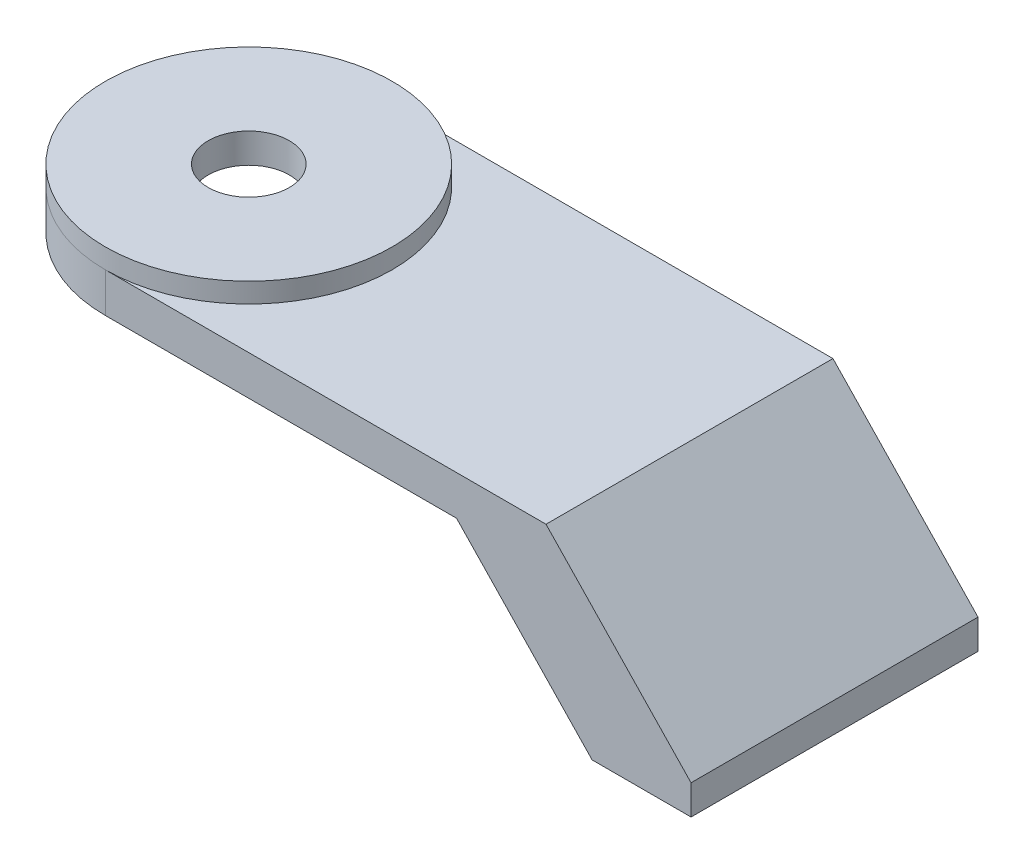
from build123d import *

# Parameters (mm, degrees)
BOSS_EXTRUDE1_DEPTH = 14.5
SKETCH3_R           = 4.1
CUT_EXTRUDE1_DEPTH  = 4
BOSS_EXTRUDE2_START = 2
SKETCH5_R           = 14.5
SKETCH5_R_2         = 4.1
BOSS_EXTRUDE2_DEPTH = 2
SKETCH6_R           = 1.55
CUT_EXTRUDE3_DEPTH  = 3
SKETCH7_R           = 10.5
CUT_EXTRUDE4_DEPTH  = 3
FILLET1_R           = 14.5
CUT_EXTRUDE5_DEPTH  = 3
SKETCH9_R           = 1.55
CUT_EXTRUDE6_DEPTH  = 3
SKETCH10_R          = 3
CUT_EXTRUDE7_DEPTH  = 2
SKETCH13_W          = 33
SKETCH13_H          = 3
CUT_EXTRUDE8_DEPTH  = 29


with BuildPart() as part:
    # Sketch2 → Boss-Extrude1 (new, symmetric)
    with BuildSketch(Plane.XY):
        Polygon((-63.7, 18.3), (-4.658041958, 18.3), (10, 3), (43, 3), (43, 0), (0, 0), (-13.7, 14.3), (-63.7, 14.3), align=None)
    extrude(amount=BOSS_EXTRUDE1_DEPTH, both=True)

    # Sketch3 → Cut-Extrude1 (cut)
    with BuildSketch(Plane(origin=(0, 18.3, 0), x_dir=(1, 0, 0), z_dir=(0, 1, 0))):
        with Locations(Location((-49.2, 0, 0), (0, 0, 270))):
            Circle(SKETCH3_R)
    extrude(amount=-CUT_EXTRUDE1_DEPTH, mode=Mode.SUBTRACT)

    # Sketch5 → Boss-Extrude2 (add)
    with BuildSketch(Plane(origin=(0, 18.3, 0), x_dir=(1, 0, 0), z_dir=(0, 1, 0)).offset(BOSS_EXTRUDE2_START)):
        with Locations(Location((-49.2, 0, 0), (0, 0, 270))):
            Circle(SKETCH5_R)
        with Locations(Location((-49.2, 0, 0), (0, 0, 270))):
            Circle(SKETCH5_R_2, mode=Mode.SUBTRACT)
    extrude(amount=-BOSS_EXTRUDE2_DEPTH)

    # Sketch6 → Cut-Extrude3 (cut)
    with BuildSketch(Plane(origin=(0, 3, 0), x_dir=(1, 0, 0), z_dir=(0, 1, 0))):
        with Locations(Location((22.248092992, -5.560176775, 0), (0, 0, 180))):
            Circle(SKETCH6_R)
        with Locations(Location((33.751907008, 5.560176775, 0), (0, 0, 180))):
            Circle(SKETCH6_R)
    extrude(amount=-CUT_EXTRUDE3_DEPTH, mode=Mode.SUBTRACT)

    # Sketch7 → Cut-Extrude4 (cut)
    with BuildSketch(Plane.XZ.offset(-14.3)):
        with Locations((-49.2, 0)):
            Circle(SKETCH7_R)
    extrude(amount=-CUT_EXTRUDE4_DEPTH, mode=Mode.SUBTRACT)

    # Fillet1
    fillet1_edges = [part.edges().sort_by_distance(p)[0] for p in [
        (-63.7, 16.3, -14.5),
        (-63.7, 16.3, 14.5),
    ]]
    fillet(fillet1_edges, radius=FILLET1_R - 0.0001)  # a hair under: the kernel refuses the full size

    # Sketch8 → Cut-Extrude5 (cut)
    with BuildSketch(Plane(origin=(0, 3, 0), x_dir=(1, 0, 0), z_dir=(0, 1, 0))):
        Polygon((16, -3.5), (10, -14.5), (16, -14.5), (43, -14.5), (43, -3.5), align=None)
    extrude(amount=-CUT_EXTRUDE5_DEPTH, mode=Mode.SUBTRACT)

    # Sketch9 → Cut-Extrude6 (cut)
    with BuildSketch(Plane(origin=(0, 3, 0), x_dir=(1, 0, 0), z_dir=(0, 1, 0))):
        with Locations(Location((22.251907008, 5.560176775, 0), (0, 0, 270))):
            Circle(SKETCH9_R)
    extrude(amount=-CUT_EXTRUDE6_DEPTH, mode=Mode.SUBTRACT)

    # Sketch10 → Cut-Extrude7 (cut)
    with BuildSketch(Plane.XZ):
        with Locations((22.251907008, -5.560176775)):
            Circle(SKETCH10_R)
        with Locations((33.751907008, -5.560176775)):
            Circle(SKETCH10_R)
    extrude(amount=-CUT_EXTRUDE7_DEPTH, mode=Mode.SUBTRACT)

    # Sketch13 → Cut-Extrude8 (cut)
    with BuildSketch(Plane(origin=(0, 0, -14.5), x_dir=(-1, 0, 0), z_dir=(0, 0, -1))):
        with Locations((-26.5, 1.5)):
            Rectangle(SKETCH13_W, SKETCH13_H)
    extrude(amount=-CUT_EXTRUDE8_DEPTH, mode=Mode.SUBTRACT)


solid = part.part
